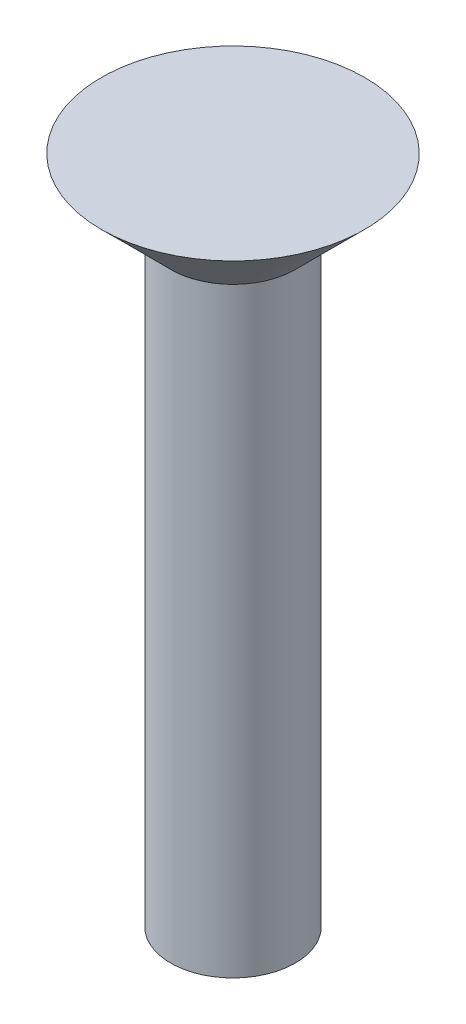
from build123d import *

# Parameters (mm, degrees)
THREADS_W = 1.35
THREADS_H = 13


with BuildPart() as part:
    # Threads → Revolve1 (revolve)
    with BuildSketch(Plane.XY):
        with Locations((0.675, 0)):
            Rectangle(THREADS_W, THREADS_H)
    revolve(axis=Axis((0, -5.706647399, 0), (0, 1, 0)))

    # Sketch5 → Flat (revolve)
    with BuildSketch(Plane.XY):
        Polygon((0, 8), (0, 6.5), (1.35, 6.5), (2.85, 8), align=None)
    revolve(axis=Axis((0, -1.12148781, 0), (0, 1, 0)))


solid = part.part
